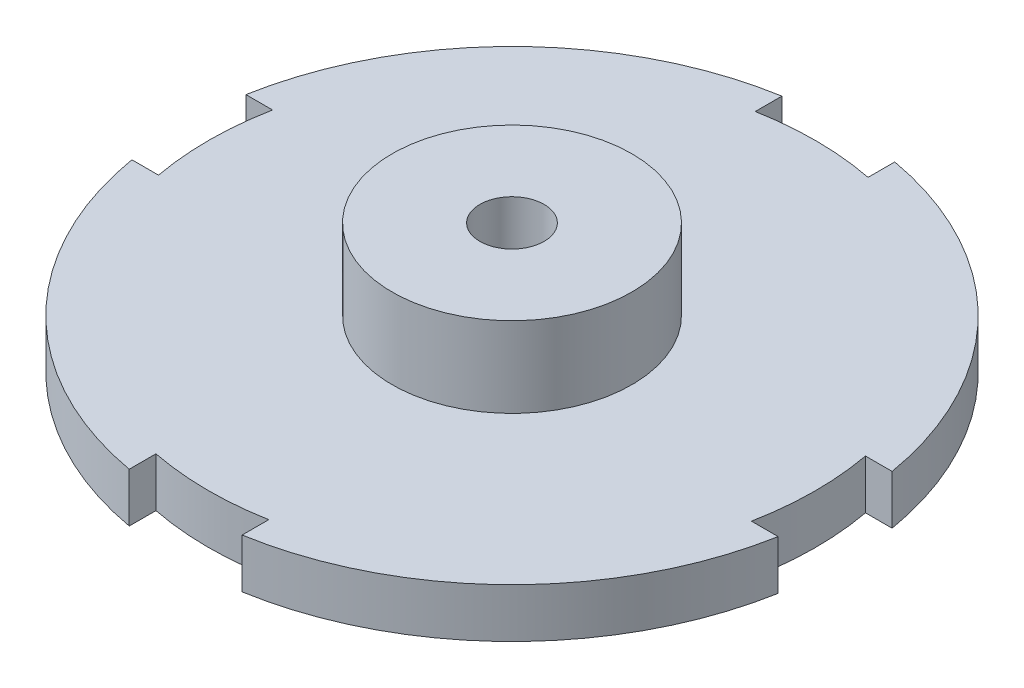
from build123d import *

# Parameters (mm, degrees)
SKETCH1_R           = 3.81
BOSS_EXTRUDE2_DEPTH = 5.842
CUT_EXTRUDE1_DEPTH  = 3.81
SKETCH3_R           = 31.75
CUT_EXTRUDE2_DEPTH  = 1.27
SKETCH4_R           = 14.224
SKETCH4_R_2         = 3.81
BOSS_EXTRUDE3_DEPTH = 9.525


with BuildPart() as part:
    # Sketch1 → Boss-Extrude2 (new body)
    with BuildSketch(Plane(origin=(0, 0, 0), x_dir=(1, 0, 0), z_dir=(0, 1, 0))):
        with BuildLine():
            Line((35.405449863, 6.5405), (38.565312338, 6.5405))
            ThreePointArc((38.565312338, 6.5405), (27.795594479, 27.522107178), (6.9215, 38.498757042))
            Line((6.9215, 38.498757042), (6.9215, 35.332942957))
            ThreePointArc((6.9215, 35.332942957), (0.19391896, 36.003977776), (-6.5405, 35.405449863))
            Line((-6.5405, 35.405449863), (-6.5405, 38.565312338))
            ThreePointArc((-6.5405, 38.565312338), (-27.522107178, 27.795594479), (-38.498757042, 6.9215))
            Line((-38.498757042, 6.9215), (-35.332942957, 6.9215))
            ThreePointArc((-35.332942957, 6.9215), (-36.003977776, 0.19391896), (-35.405449863, -6.5405))
            Line((-35.405449863, -6.5405), (-38.565312338, -6.5405))
            ThreePointArc((-38.565312338, -6.5405), (-27.795594479, -27.522107178), (-6.9215, -38.498757042))
            Line((-6.9215, -38.498757042), (-6.9215, -35.332942957))
            ThreePointArc((-6.9215, -35.332942957), (-0.19391896, -36.003977776), (6.5405, -35.405449863))
            Line((6.5405, -35.405449863), (6.5405, -38.565312338))
            ThreePointArc((6.5405, -38.565312338), (27.522107178, -27.795594479), (38.498757042, -6.9215))
            Line((38.498757042, -6.9215), (35.332942957, -6.9215))
            ThreePointArc((35.332942957, -6.9215), (36.003977776, -0.19391896), (35.405449863, 6.5405))
        make_face()
        Circle(SKETCH1_R, mode=Mode.SUBTRACT)
    extrude(amount=BOSS_EXTRUDE2_DEPTH)

    # Sketch2 → Cut-Extrude1 (cut)
    with BuildSketch(Plane.XZ):
        with BuildLine():
            Line((17.377665752, -10.033), (-0.286554615, -40.628327152))
            ThreePointArc((-0.286554615, -40.628327152), (-2.416432138, -40.557415308), (-4.539661745, -40.374924792))
            Line((-4.539661745, -40.374924792), (8.196212586, -18.315743371))
            ThreePointArc((8.196212586, -18.315743371), (-13.440862054, 14.899247741), (17.377665752, -10.033))
        make_face()
    extrude(amount=-CUT_EXTRUDE1_DEPTH, mode=Mode.SUBTRACT)

    # Sketch3 → Cut-Extrude2 (cut)
    with BuildSketch(Plane.XZ):
        Circle(SKETCH3_R)
    extrude(amount=-CUT_EXTRUDE2_DEPTH, mode=Mode.SUBTRACT)

    # Sketch4 → Boss-Extrude3 (add)
    with BuildSketch(Plane(origin=(0, 5.842, 0), x_dir=(1, 0, 0), z_dir=(0, 1, 0))):
        Circle(SKETCH4_R)
        Circle(SKETCH4_R_2, mode=Mode.SUBTRACT)
    extrude(amount=BOSS_EXTRUDE3_DEPTH)


solid = part.part
